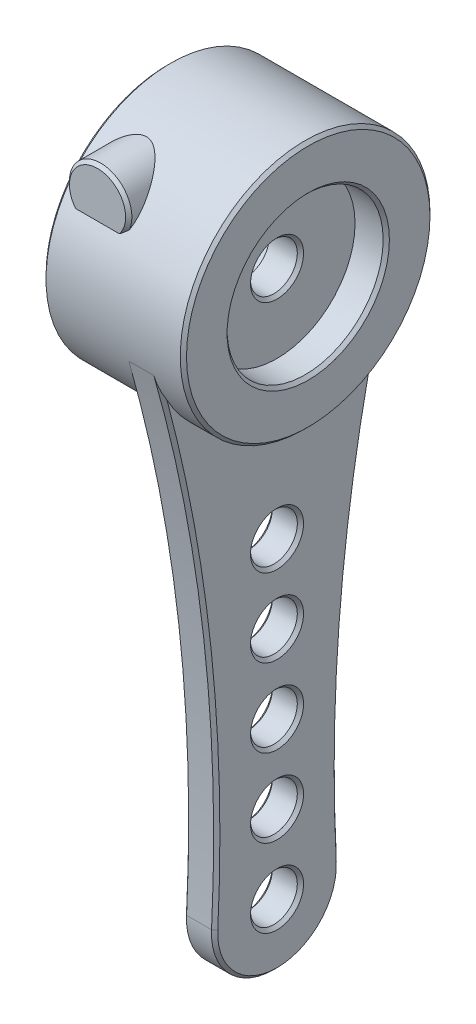
from build123d import *

# Parameters (mm, degrees)
SKETCH_1_R          = 8
EXTRUDE_1_DEPTH     = 9
SKETCH_2_R          = 5
CUT_EXTRUDE_1_DEPTH = 2
SKETCH_3_R          = 1.5
CUT_EXTRUDE_2_DEPTH = 2
SKETCH_4_R          = 3
CUT_EXTRUDE_3_DEPTH = 5
SKETCH_6_R          = 2
EXTRUDE_2_DEPTH     = 7
SKETCH_7_R          = 1.5
EXTRUDE_3_DEPTH     = 2
CHAMFER_1_SIZE      = 0.2
CHAMFER_2_SIZE      = 0.2


with BuildPart() as part:
    # 草图1 → 凸台-拉伸1 (new body)
    with BuildSketch(Plane(origin=(0, 0, 0), x_dir=(0, 0, -1), z_dir=(1, 0, 0))):
        Circle(SKETCH_1_R)
    extrude(amount=EXTRUDE_1_DEPTH)

    # 草图2 → 切除-拉伸1 (cut)
    with BuildSketch(Plane(origin=(9, 0, 0), x_dir=(0, 0, -1), z_dir=(1, 0, 0))):
        Circle(SKETCH_2_R)
    extrude(amount=-CUT_EXTRUDE_1_DEPTH, mode=Mode.SUBTRACT)

    # 草图3 → 切除-拉伸2 (cut)
    with BuildSketch(Plane(origin=(7, 0, 0), x_dir=(0, 0, -1), z_dir=(1, 0, 0))):
        Circle(SKETCH_3_R)
    extrude(amount=-CUT_EXTRUDE_2_DEPTH, mode=Mode.SUBTRACT)

    # 草图4 → 切除-拉伸3 (cut)
    with BuildSketch(Plane(origin=(5, 0, 0), x_dir=(0, 0, -1), z_dir=(1, 0, 0))):
        Circle(SKETCH_4_R)
    extrude(amount=-CUT_EXTRUDE_3_DEPTH, mode=Mode.SUBTRACT)

    # 草图6 → 凸台-拉伸2 (add)
    with BuildSketch(Plane.XY):
        with Locations((2.5, 5)):
            Circle(SKETCH_6_R)
    extrude(amount=EXTRUDE_2_DEPTH)

    # 草图7 → 凸台-拉伸3 (add)
    with BuildSketch(Plane.ZY.offset(-5)):
        with BuildLine():
            ThreePointArc((-3.994632879, -34.792857143), (0, -39), (3.994632879, -34.792857143))
            ThreePointArc((3.994632879, -34.792857143), (4.497974535, -18.34053276), (7.693367026, -2.193650794))
            ThreePointArc((7.693367026, -2.193650794), (0, -8), (-7.693367026, -2.193650794))
            ThreePointArc((-7.693367026, -2.193650794), (-4.497974535, -18.34053276), (-3.994632879, -34.792857143))
        make_face()
        with Locations((0, -35)):
            Circle(SKETCH_7_R, mode=Mode.SUBTRACT)
        with Locations((0, -30)):
            Circle(SKETCH_7_R, mode=Mode.SUBTRACT)
        with Locations((0, -25)):
            Circle(SKETCH_7_R, mode=Mode.SUBTRACT)
        with Locations((0, -20)):
            Circle(SKETCH_7_R, mode=Mode.SUBTRACT)
        with Locations((0, -15)):
            Circle(SKETCH_7_R, mode=Mode.SUBTRACT)
    extrude(amount=-EXTRUDE_3_DEPTH)

    # 倒角1
    # the kernel refuses this chamfer: 0.2 mm, written as the material it takes off along each edge
    with BuildSketch(Plane(origin=(2.5, 5, 7), x_dir=(0.6550221051171238, -0.7556097152683597, 0), z_dir=(-0.7556097152683597, -0.6550221051171238, 0))) as chamfer_1_piece_1_section:
        Polygon((2 - CHAMFER_1_SIZE, 0), (2, -CHAMFER_1_SIZE), (2, 0), align=None)
    chamfer_1_piece_1 = revolve(axis=Axis((2.5, 5, 7), (0, 0, 1)), revolution_arc=278.157347794, mode=Mode.PRIVATE)
    chamfer_1_piece_1 = chamfer_1_piece_1 - Plane(origin=(2.5, 0, 0), x_dir=(0, 0, -1), z_dir=(-1, 0, 0)) * Cylinder(8, 9, mode=Mode.PRIVATE)
    add(chamfer_1_piece_1, mode=Mode.SUBTRACT)
    with BuildSketch(Plane(origin=(0, 0, 0), x_dir=(0, 0, -1), z_dir=(0, -1, 0))) as chamfer_1_piece_2:
        Polygon((3 + CHAMFER_1_SIZE, 0), (3, CHAMFER_1_SIZE), (3, 0), align=None)
    revolve(axis=Axis((0, 0, 0), (1, 0, 0)), mode=Mode.SUBTRACT)
    with BuildSketch(Plane(origin=(0, 0, 0), x_dir=(0, 0, -1), z_dir=(0, -1, 0))) as chamfer_1_piece_3:
        Polygon((8, CHAMFER_1_SIZE), (8 - CHAMFER_1_SIZE, 0), (8, 0), align=None)
    revolve(axis=Axis((0, 0, 0), (1, 0, 0)), mode=Mode.SUBTRACT)
    with BuildSketch(Plane(origin=(7, 0, 0), x_dir=(0, 0, -1), z_dir=(0, -1, 0))) as chamfer_1_piece_4:
        Polygon((1.5 + CHAMFER_1_SIZE, 0), (1.5, -CHAMFER_1_SIZE), (1.5, 0), align=None)
    revolve(axis=Axis((7, 0, 0), (1, 0, 0)), mode=Mode.SUBTRACT)
    with BuildSketch(Plane(origin=(9, 0, 0), x_dir=(0, 0, -1), z_dir=(0, -1, 0))) as chamfer_1_piece_5:
        Polygon((5 + CHAMFER_1_SIZE, 0), (5, -CHAMFER_1_SIZE), (5, 0), align=None)
    revolve(axis=Axis((9, 0, 0), (1, 0, 0)), mode=Mode.SUBTRACT)
    with BuildSketch(Plane(origin=(9, 0, 0), x_dir=(0, 0, -1), z_dir=(0, -1, 0))) as chamfer_1_piece_6:
        Polygon((8, -CHAMFER_1_SIZE), (8 - CHAMFER_1_SIZE, 0), (8, 0), align=None)
    revolve(axis=Axis((9, 0, 0), (1, 0, 0)), mode=Mode.SUBTRACT)

    # 倒角2
    # the kernel refuses this chamfer: 0.2 mm, written as the material it takes off along each edge
    with BuildSketch(Plane(origin=(7, -29.614285714, 103.86045485), x_dir=(0, -0.05178571428571552, -0.9986582197107868), z_dir=(0, -0.9986582197107868, 0.05178571428571552))) as chamfer_2_piece_1_section:
        Polygon((100, -CHAMFER_2_SIZE), (100 + CHAMFER_2_SIZE, 0), (100, 0), align=None)
    chamfer_2_piece_1 = revolve(axis=Axis((7, -29.614285714, 103.86045485), (1, 0, 0)), revolution_arc=20.356645861, mode=Mode.PRIVATE)
    chamfer_2_piece_1 = chamfer_2_piece_1 - Plane(origin=(7, 0, 0), x_dir=(0, 0, -1), z_dir=(-1, 0, 0)) * Cylinder(8, 401, mode=Mode.PRIVATE)
    add(chamfer_2_piece_1, mode=Mode.SUBTRACT)
    with BuildSketch(Plane(origin=(7, -35, 0), x_dir=(0, 0.05178571428571369, -0.9986582197107869), z_dir=(0, 0.9986582197107869, 0.05178571428571369))) as chamfer_2_piece_2:
        Polygon((4 - CHAMFER_2_SIZE, 0), (4, CHAMFER_2_SIZE), (4, 0), align=None)
    revolve(axis=Axis((7, -35, 0), (-1, 0, 0)), revolution_arc=185.936861294, mode=Mode.SUBTRACT)
    with BuildSketch(Plane(origin=(7, -29.614285714, -103.86045485), x_dir=(0, 0.29884451461423694, 0.9543018160335759), z_dir=(0, 0.9543018160335759, -0.29884451461423694))) as chamfer_2_piece_3_section:
        Polygon((100 + CHAMFER_2_SIZE, 0), (100, -CHAMFER_2_SIZE), (100, 0), align=None)
    chamfer_2_piece_3 = revolve(axis=Axis((7, -29.614285714, -103.86045485), (1, 0, 0)), revolution_arc=20.356645861, mode=Mode.PRIVATE)
    chamfer_2_piece_3 = chamfer_2_piece_3 - Plane(origin=(7, 0, 0), x_dir=(0, 0, -1), z_dir=(-1, 0, 0)) * Cylinder(8, 401, mode=Mode.PRIVATE)
    add(chamfer_2_piece_3, mode=Mode.SUBTRACT)
    with BuildSketch(Plane(origin=(7, -15, 0), x_dir=(0, 0, 1), z_dir=(0, -1, 0))) as chamfer_2_piece_4:
        Polygon((1.5 + CHAMFER_2_SIZE, 0), (1.5, CHAMFER_2_SIZE), (1.5, 0), align=None)
    revolve(axis=Axis((7, -15, 0), (-1, 0, 0)), mode=Mode.SUBTRACT)
    with BuildSketch(Plane(origin=(7, -20, 0), x_dir=(0, 0, 1), z_dir=(0, -1, 0))) as chamfer_2_piece_5:
        Polygon((1.5 + CHAMFER_2_SIZE, 0), (1.5, CHAMFER_2_SIZE), (1.5, 0), align=None)
    revolve(axis=Axis((7, -20, 0), (-1, 0, 0)), mode=Mode.SUBTRACT)
    with BuildSketch(Plane(origin=(7, -25, 0), x_dir=(0, 0, 1), z_dir=(0, -1, 0))) as chamfer_2_piece_6:
        Polygon((1.5 + CHAMFER_2_SIZE, 0), (1.5, CHAMFER_2_SIZE), (1.5, 0), align=None)
    revolve(axis=Axis((7, -25, 0), (-1, 0, 0)), mode=Mode.SUBTRACT)
    with BuildSketch(Plane(origin=(7, -30, 0), x_dir=(0, 0, 1), z_dir=(0, -1, 0))) as chamfer_2_piece_7:
        Polygon((1.5 + CHAMFER_2_SIZE, 0), (1.5, CHAMFER_2_SIZE), (1.5, 0), align=None)
    revolve(axis=Axis((7, -30, 0), (-1, 0, 0)), mode=Mode.SUBTRACT)
    with BuildSketch(Plane(origin=(7, -35, 0), x_dir=(0, 0, 1), z_dir=(0, -1, 0))) as chamfer_2_piece_8:
        Polygon((1.5 + CHAMFER_2_SIZE, 0), (1.5, CHAMFER_2_SIZE), (1.5, 0), align=None)
    revolve(axis=Axis((7, -35, 0), (-1, 0, 0)), mode=Mode.SUBTRACT)
    with BuildSketch(Plane(origin=(5, -29.614285714, -103.86045485), x_dir=(0, 0.29884451461423694, 0.9543018160335759), z_dir=(0, 0.9543018160335759, -0.29884451461423694))) as chamfer_2_piece_9_section:
        Polygon((100 + CHAMFER_2_SIZE, 0), (100, CHAMFER_2_SIZE), (100, 0), align=None)
    chamfer_2_piece_9 = revolve(axis=Axis((5, -29.614285714, -103.86045485), (1, 0, 0)), revolution_arc=20.356645861, mode=Mode.PRIVATE)
    chamfer_2_piece_9 = chamfer_2_piece_9 - Plane(origin=(5, 0, 0), x_dir=(0, 0, -1), z_dir=(-1, 0, 0)) * Cylinder(8, 401, mode=Mode.PRIVATE)
    add(chamfer_2_piece_9, mode=Mode.SUBTRACT)
    with BuildSketch(Plane(origin=(5, -35, 0), x_dir=(0, 0.05178571428571369, -0.9986582197107869), z_dir=(0, 0.9986582197107869, 0.05178571428571369))) as chamfer_2_piece_10:
        Polygon((4 - CHAMFER_2_SIZE, 0), (4, -CHAMFER_2_SIZE), (4, 0), align=None)
    revolve(axis=Axis((5, -35, 0), (-1, 0, 0)), revolution_arc=185.936861294, mode=Mode.SUBTRACT)
    with BuildSketch(Plane(origin=(5, -29.614285714, 103.86045485), x_dir=(0, -0.05178571428571552, -0.9986582197107868), z_dir=(0, -0.9986582197107868, 0.05178571428571552))) as chamfer_2_piece_11_section:
        Polygon((100, CHAMFER_2_SIZE), (100 + CHAMFER_2_SIZE, 0), (100, 0), align=None)
    chamfer_2_piece_11 = revolve(axis=Axis((5, -29.614285714, 103.86045485), (1, 0, 0)), revolution_arc=20.356645861, mode=Mode.PRIVATE)
    chamfer_2_piece_11 = chamfer_2_piece_11 - Plane(origin=(5, 0, 0), x_dir=(0, 0, -1), z_dir=(-1, 0, 0)) * Cylinder(8, 401, mode=Mode.PRIVATE)
    add(chamfer_2_piece_11, mode=Mode.SUBTRACT)
    with BuildSketch(Plane(origin=(5, -35, 0), x_dir=(0, 0, 1), z_dir=(0, -1, 0))) as chamfer_2_piece_12:
        Polygon((1.5 + CHAMFER_2_SIZE, 0), (1.5, -CHAMFER_2_SIZE), (1.5, 0), align=None)
    revolve(axis=Axis((5, -35, 0), (-1, 0, 0)), mode=Mode.SUBTRACT)
    with BuildSketch(Plane(origin=(5, -30, 0), x_dir=(0, 0, 1), z_dir=(0, -1, 0))) as chamfer_2_piece_13:
        Polygon((1.5 + CHAMFER_2_SIZE, 0), (1.5, -CHAMFER_2_SIZE), (1.5, 0), align=None)
    revolve(axis=Axis((5, -30, 0), (-1, 0, 0)), mode=Mode.SUBTRACT)
    with BuildSketch(Plane(origin=(5, -25, 0), x_dir=(0, 0, 1), z_dir=(0, -1, 0))) as chamfer_2_piece_14:
        Polygon((1.5 + CHAMFER_2_SIZE, 0), (1.5, -CHAMFER_2_SIZE), (1.5, 0), align=None)
    revolve(axis=Axis((5, -25, 0), (-1, 0, 0)), mode=Mode.SUBTRACT)
    with BuildSketch(Plane(origin=(5, -20, 0), x_dir=(0, 0, 1), z_dir=(0, -1, 0))) as chamfer_2_piece_15:
        Polygon((1.5 + CHAMFER_2_SIZE, 0), (1.5, -CHAMFER_2_SIZE), (1.5, 0), align=None)
    revolve(axis=Axis((5, -20, 0), (-1, 0, 0)), mode=Mode.SUBTRACT)
    with BuildSketch(Plane(origin=(5, -15, 0), x_dir=(0, 0, 1), z_dir=(0, -1, 0))) as chamfer_2_piece_16:
        Polygon((1.5 + CHAMFER_2_SIZE, 0), (1.5, -CHAMFER_2_SIZE), (1.5, 0), align=None)
    revolve(axis=Axis((5, -15, 0), (-1, 0, 0)), mode=Mode.SUBTRACT)


solid = part.part
